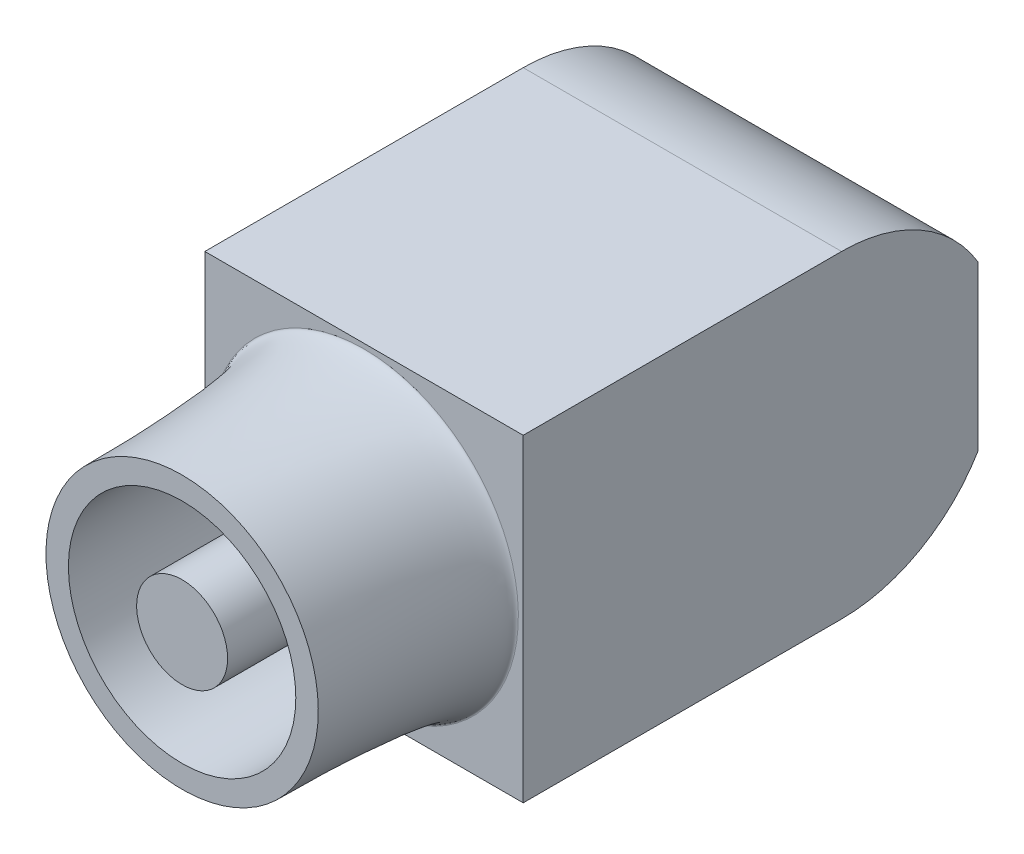
from build123d import *

# Parameters (mm, degrees)
AUFSATZ_LINEAR_AUSTRAGEN1_DEPTH = 35
SKIZZE3_R                       = 14.969948268
SKIZZE3_R_2                     = 12.5
SKIZZE3_R_3                     = 5
AUFSATZ_LINEAR_AUSTRAGEN2_DEPTH = 20
VERRUNDUNG1_SIZE                = 2
VERRUNDUNG1_SIZE_2              = 20
SKIZZE4_R                       = 5
AUFSATZ_LINEAR_AUSTRAGEN3_DEPTH = 2


with BuildPart() as part:
    # Skizze2 → Aufsatz-Linear austragen1 (new body)
    with BuildSketch(Plane(origin=(0, 0, 0), x_dir=(0, 0, -1), z_dir=(1, 0, 0))):
        with BuildLine():
            Line((-35, -17.5), (3.5e-08, -17.5))
            ThreePointArc((3.5e-08, -17.5), (8.617050894, -15.231429148), (15, -9.013878189))
            Line((15, -9.013878189), (15, 9.013878189))
            ThreePointArc((15, 9.013878189), (8.61705092, 15.231429133), (9.5e-08, 17.5))
            Line((9.5e-08, 17.5), (-35, 17.5))
            Line((-35, 17.5), (-35, -17.5))
        make_face()
    extrude(amount=AUFSATZ_LINEAR_AUSTRAGEN1_DEPTH)

    # Skizze3 → Aufsatz-Linear austragen2 (add)
    # profile 1 of 2: a face of its own
    with BuildSketch(Plane.XY.offset(35)):
        with Locations(Location((17.5, 0, 0), (0, 0, 90))):
            Circle(SKIZZE3_R)
        with Locations((17.5, 0)):
            Circle(SKIZZE3_R_2, mode=Mode.SUBTRACT)
    # profile 2 of 2: a face of its own
    with BuildSketch(Plane.XY.offset(35)):
        with Locations(Location((17.5, 0, 0), (0, 0, 90))):
            Circle(SKIZZE3_R_3)
    extrude(amount=AUFSATZ_LINEAR_AUSTRAGEN2_DEPTH)

    # Verrundung1
    # an asymmetric fillet: 20, 2 mm, written as the material it adds along each edge
    with BuildSketch(Plane(origin=(17.5, 0, 35), x_dir=(0, 1, 0), z_dir=(1, 0, 0))) as verrundung1_piece_1:
        with BuildLine():
            Bezier((14.969948268 + VERRUNDUNG1_SIZE, 0), (14.969948268, 0), (14.969948268, VERRUNDUNG1_SIZE_2), weights=[1, 0.707106781, 1])
            Line((14.969948268, VERRUNDUNG1_SIZE_2), (14.969948268, 0))
            Line((14.969948268, 0), (14.969948268 + VERRUNDUNG1_SIZE, 0))
        make_face()
    revolve(axis=Axis((17.5, 0, 35), (0, 0, 1)))

    # Skizze4 → Aufsatz-Linear austragen3 (add)
    with BuildSketch(Plane.ZY):
        with Locations(Location((0, 0, 0), (0, 0, 180))):
            Circle(SKIZZE4_R)
    extrude(amount=AUFSATZ_LINEAR_AUSTRAGEN3_DEPTH)


solid = part.part
